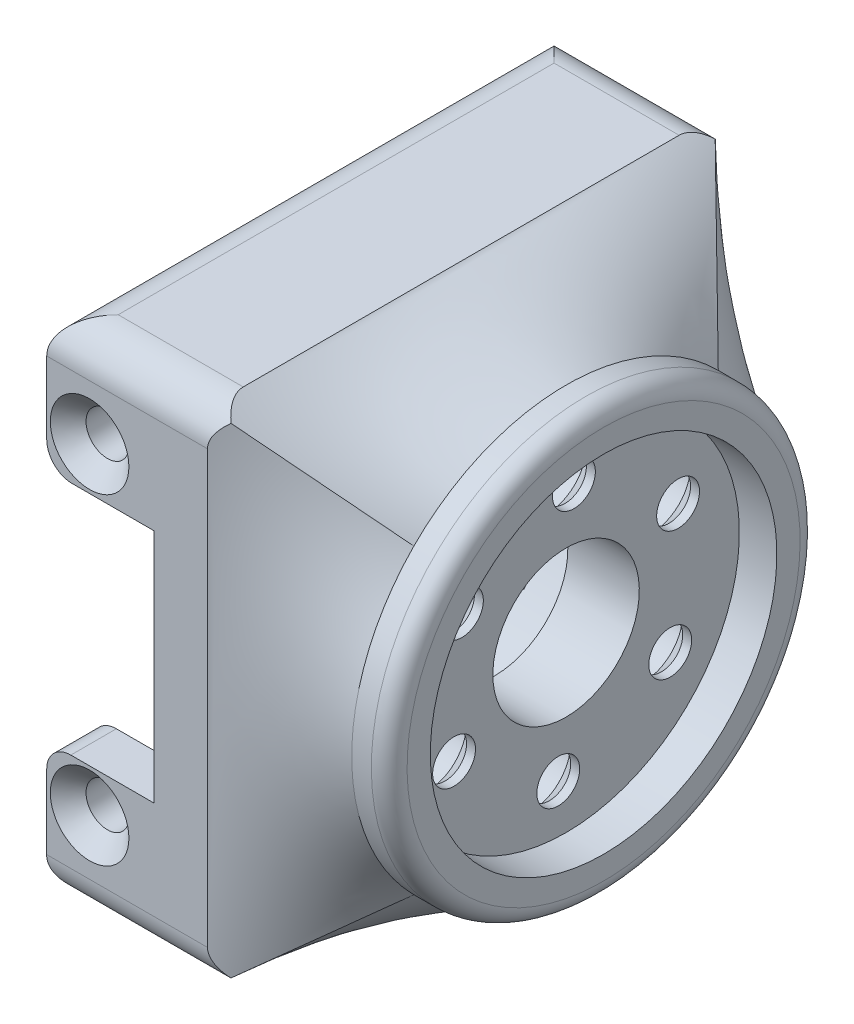
from build123d import *

# Parameters (mm, degrees)
BOSS_EXTRUDE1_DEPTH                                  = 2.5
BOSS_EXTRUDE1_DEPTH_BACK                             = 25.9
CUT_EXTRUDE1_START                                   = -12.2500003
CUT_EXTRUDE1_DEPTH                                   = 24.500001543
CUT_EXTRUDE2_DEPTH                                   = 34.493305247
CUT_EXTRUDE2_DEPTH_BACK                              = 34.493305247
SKETCH6_R                                            = 11.999999661
SKETCH6_R_2                                          = 9.7
BOSS_EXTRUDE2_DEPTH                                  = 2.1
CSK_FOR_M2_COUNTERSUNK_RAISED_HEAD_SCREW_D           = 2.4
CSK_FOR_M2_COUNTERSUNK_RAISED_HEAD_SCREW_DEPTH       = 4
CSK_FOR_M2_COUNTERSUNK_RAISED_HEAD_SCREW_CSINK_D     = 4.4
CSK_FOR_M2_COUNTERSUNK_RAISED_HEAD_SCREW_CSINK_ANGLE = 90
CSK_FOR_M2_COUNTERSUNK_RAISED_HEAD_SCREW_TIP         = 0.721032743
CSK_FOR_M2_COUNTERSUNK_RAISED_HEAD_S_2_D             = 2.4
CSK_FOR_M2_COUNTERSUNK_RAISED_HEAD_S_2_DEPTH         = 4
CSK_FOR_M2_COUNTERSUNK_RAISED_HEAD_S_2_CSINK_D       = 4.4
CSK_FOR_M2_COUNTERSUNK_RAISED_HEAD_S_2_CSINK_ANGLE   = 90
CSK_FOR_M2_COUNTERSUNK_RAISED_HEAD_S_2_TIP           = 0.721032743
CUT_EXTRUDE3_DEPTH                                   = 32.82678972
CUT_EXTRUDE3_DEPTH_BACK                              = 5.871823
SKETCH13_R                                           = 10
CSK_FOR_M2_COUNTERSUNK_RAISED_HEAD_S_3_A_COUNT       = 2
CSK_FOR_M2_COUNTERSUNK_RAISED_HEAD_S_3_A_PITCH       = 7
CSK_FOR_M2_COUNTERSUNK_RAISED_HEAD_S_4_COUNT         = 2
CSK_FOR_M2_COUNTERSUNK_RAISED_HEAD_S_4_PITCH         = 12.124355653
CSK_FOR_M2_COUNTERSUNK_RAISED_HEAD_S_5_COUNT         = 2
CSK_FOR_M2_COUNTERSUNK_RAISED_HEAD_S_5_PITCH         = 14
CSK_FOR_M2_COUNTERSUNK_RAISED_HEAD_S_6_COUNT         = 2
CSK_FOR_M2_COUNTERSUNK_RAISED_HEAD_S_6_PITCH         = 12.124355653
CSK_FOR_M2_COUNTERSUNK_RAISED_HEAD_S_7_COUNT         = 2
CSK_FOR_M2_COUNTERSUNK_RAISED_HEAD_S_7_PITCH         = 7
FILLET1_R                                            = 2
FILLET2_R                                            = 1


with BuildPart() as part:
    # Sketch1 → Boss-Extrude1 (new, two sides: drawn at the far end of the back side and taken through both)
    with BuildSketch(Plane.XY.offset(-BOSS_EXTRUDE1_DEPTH_BACK)):
        with BuildLine():
            Line((29.928177417, 11.570634763), (29.928177417, 14.070634763))
            Line((29.928177417, 14.070634763), (38.928177148, 14.070634763))
            Line((38.928177148, 14.070634763), (38.928177148, -14.099999768))
            Line((38.928177148, -14.099999768), (29.91977661, -14.099999768))
            Line((29.91977661, -14.099999768), (29.91977661, -11.599999768))
            ThreePointArc((29.91977661, -11.599999768), (29.926074346, -11.550137868), (29.928177417, -11.499923848))
            Line((29.928177417, -11.499923848), (29.928177417, -7.95))
            ThreePointArc((29.928177417, -7.95), (30.323588466, -6.995400641), (31.278192136, -6.6))
            Line((31.278192136, -6.6), (34.928177148, -6.6))
            Line((34.928177148, -6.6), (35.928177148, -6.6))
            Line((35.928177148, -6.6), (35.928177148, 6.6))
            Line((35.928177148, 6.6), (35.087455795, 6.6))
            Line((35.087455795, 6.6), (31.348888095, 6.6))
            ThreePointArc((31.348888095, 6.6), (30.34429394, 7.016116524), (29.928177417, 8.020710678))
            Line((29.928177417, 8.020710678), (29.928177417, 11.570634763))
        make_face()
    extrude(amount=BOSS_EXTRUDE1_DEPTH + BOSS_EXTRUDE1_DEPTH_BACK)

    # Cut-Extrude1: read off the stored shape, not the designer's step
    # Cut-Extrude1 outline → Cut-Extrude1 (cut)
    with BuildSketch(Plane(origin=(0, 0, 0), x_dir=(1, 0, 0), z_dir=(0, 1, 0)).offset(CUT_EXTRUDE1_START)):
        Polygon((35.195879318, 0.050001172), (35.36404868, 24.138096471), (29.91977661, 24.138096471), (29.91977661, 0.050001172), align=None)
    extrude(amount=CUT_EXTRUDE1_DEPTH, mode=Mode.SUBTRACT)

    # Loft1: read off the stored shape, not the designer's step
    # Loft1: loft between two sections, ruled curve by curve
    loft1_from = [
        Edge.make_bspline([(45.8, -8.450808127, -2.180385345), (45.8, -7.95082458, -1.684439789), (45.8, -7.388421064, -1.214398248), (45.8, -6.146508219, -0.366276416), (45.8, -5.466939506, 0.01153308), (45.8, -4.015161183, 0.635909719), (45.8, -3.243064682, 0.882176609), (45.8, -1.647180674, 1.214322446), (45.8, -0.823680968, 1.299999661), (45.8, 0.823680968, 1.299999661), (45.8, 1.647180674, 1.214322446), (45.8, 3.243064682, 0.882176609), (45.8, 4.015161183, 0.635909719), (45.8, 5.466939506, 0.01153308), (45.8, 6.146508219, -0.366276416), (45.8, 7.388421064, -1.214398248), (45.8, 7.95082458, -1.684439789), (45.8, 8.450808127, -2.180385345)], [0, 0, 0, 0, 0.125, 0.125, 0.25, 0.25, 0.375, 0.375, 0.5, 0.5, 0.625, 0.625, 0.75, 0.75, 0.875, 0.875, 1, 1, 1, 1], 3),
        Edge.make_bspline([(45.8, 8.450808127, -2.180385345), (45.8, 8.954862543, -2.680368892), (45.8, 9.433327263, -3.244228398), (45.8, 10.297629636, -4.492342043), (45.8, 10.683183568, -5.176664124), (45.8, 11.320842078, -6.64091328), (45.8, 11.572628128, -7.420725214), (45.8, 11.912314661, -9.03382944), (45.8, 11.999999661, -9.866818787), (45.8, 11.999999661, -11.533181213), (45.8, 11.912314661, -12.36617056), (45.8, 11.572628128, -13.979274786), (45.8, 11.320842078, -14.75908672), (45.8, 10.683183568, -16.223335876), (45.8, 10.297629636, -16.907657957), (45.8, 9.433327263, -18.155771602), (45.8, 8.954862543, -18.719631108), (45.8, 8.450808127, -19.219614655)], [0, 0, 0, 0, 0.125, 0.125, 0.25, 0.25, 0.375, 0.375, 0.5, 0.5, 0.625, 0.625, 0.75, 0.75, 0.875, 0.875, 1, 1, 1, 1], 3),
        Edge.make_bspline([(45.8, -8.450808127, -19.219614655), (45.8, -8.954862543, -18.719631108), (45.8, -9.433327263, -18.155771602), (45.8, -10.297629636, -16.907657957), (45.8, -10.683183568, -16.223335876), (45.8, -11.320842078, -14.75908672), (45.8, -11.572628128, -13.979274786), (45.8, -11.912314661, -12.36617056), (45.8, -11.999999661, -11.533181213), (45.8, -11.999999661, -9.866818787), (45.8, -11.912314661, -9.03382944), (45.8, -11.572628128, -7.420725214), (45.8, -11.320842078, -6.64091328), (45.8, -10.683183568, -5.176664124), (45.8, -10.297629636, -4.492342043), (45.8, -9.433327263, -3.244228398), (45.8, -8.954862543, -2.680368892), (45.8, -8.450808127, -2.180385345)], [0, 0, 0, 0, 0.125, 0.125, 0.25, 0.25, 0.375, 0.375, 0.5, 0.5, 0.625, 0.625, 0.75, 0.75, 0.875, 0.875, 1, 1, 1, 1], 3),
        Edge.make_bspline([(45.8, 8.450808127, -19.219614655), (45.8, 7.95082458, -19.715560211), (45.8, 7.388421064, -20.185601752), (45.8, 6.146508219, -21.033723584), (45.8, 5.466939506, -21.41153308), (45.8, 4.015161183, -22.035909719), (45.8, 3.243064682, -22.282176609), (45.8, 1.647180674, -22.614322446), (45.8, 0.823680968, -22.699999661), (45.8, -0.823680968, -22.699999661), (45.8, -1.647180674, -22.614322446), (45.8, -3.243064682, -22.282176609), (45.8, -4.015161183, -22.035909719), (45.8, -5.466939506, -21.41153308), (45.8, -6.146508219, -21.033723584), (45.8, -7.388421064, -20.185601752), (45.8, -7.95082458, -19.715560211), (45.8, -8.450808127, -19.219614655)], [0, 0, 0, 0, 0.125, 0.125, 0.25, 0.25, 0.375, 0.375, 0.5, 0.5, 0.625, 0.625, 0.75, 0.75, 0.875, 0.875, 1, 1, 1, 1], 3),
    ]
    loft1_to = [
        Edge.make_bspline([(38.928177148, -14.099999768, 2.5), (38.928177148, -12.92622333, 2.5), (38.928177148, -11.752446891, 2.5), (38.928177148, -9.404894013, 2.5), (38.928177148, -8.231117574, 2.5), (38.928177148, -5.883564697, 2.5), (38.928177148, -4.709788258, 2.5), (38.928177148, -2.36223538, 2.5), (38.928177148, -1.188458942, 2.5), (38.928177148, 1.159093936, 2.5), (38.928177148, 2.332870375, 2.5), (38.928177148, 4.680423252, 2.5), (38.928177148, 5.854199691, 2.5), (38.928177148, 8.201752569, 2.5), (38.928177148, 9.375529008, 2.5), (38.928177148, 11.723081885, 2.5), (38.928177148, 12.896858324, 2.5), (38.928177148, 14.070634763, 2.5)], [0, 0, 0, 0, 0.125, 0.125, 0.25, 0.25, 0.375, 0.375, 0.5, 0.5, 0.625, 0.625, 0.75, 0.75, 0.875, 0.875, 1, 1, 1, 1], 3),
        Edge.make_bspline([(38.928177148, 14.070634763, 2.5), (38.928177148, 14.070634763, 1.316666667), (38.928177148, 14.070634763, 0.133333333), (38.928177148, 14.070634763, -2.233333333), (38.928177148, 14.070634763, -3.416666667), (38.928177148, 14.070634763, -5.783333333), (38.928177148, 14.070634763, -6.966666667), (38.928177148, 14.070634763, -9.333333333), (38.928177148, 14.070634763, -10.516666667), (38.928177148, 14.070634763, -12.883333333), (38.928177148, 14.070634763, -14.066666667), (38.928177148, 14.070634763, -16.433333333), (38.928177148, 14.070634763, -17.616666667), (38.928177148, 14.070634763, -19.983333333), (38.928177148, 14.070634763, -21.166666667), (38.928177148, 14.070634763, -23.533333333), (38.928177148, 14.070634763, -24.716666667), (38.928177148, 14.070634763, -25.9)], [0, 0, 0, 0, 0.125, 0.125, 0.25, 0.25, 0.375, 0.375, 0.5, 0.5, 0.625, 0.625, 0.75, 0.75, 0.875, 0.875, 1, 1, 1, 1], 3),
        Edge.make_bspline([(38.928177148, -14.099999768, -25.9), (38.928177148, -14.099999768, -24.716666667), (38.928177148, -14.099999768, -23.533333333), (38.928177148, -14.099999768, -21.166666667), (38.928177148, -14.099999768, -19.983333333), (38.928177148, -14.099999768, -17.616666667), (38.928177148, -14.099999768, -16.433333333), (38.928177148, -14.099999768, -14.066666667), (38.928177148, -14.099999768, -12.883333333), (38.928177148, -14.099999768, -10.516666667), (38.928177148, -14.099999768, -9.333333333), (38.928177148, -14.099999768, -6.966666667), (38.928177148, -14.099999768, -5.783333333), (38.928177148, -14.099999768, -3.416666667), (38.928177148, -14.099999768, -2.233333333), (38.928177148, -14.099999768, 0.133333333), (38.928177148, -14.099999768, 1.316666667), (38.928177148, -14.099999768, 2.5)], [0, 0, 0, 0, 0.125, 0.125, 0.25, 0.25, 0.375, 0.375, 0.5, 0.5, 0.625, 0.625, 0.75, 0.75, 0.875, 0.875, 1, 1, 1, 1], 3),
        Edge.make_bspline([(38.928177148, 14.070634763, -25.9), (38.928177148, 12.896858324, -25.9), (38.928177148, 11.723081885, -25.9), (38.928177148, 9.375529008, -25.9), (38.928177148, 8.201752569, -25.9), (38.928177148, 5.854199691, -25.9), (38.928177148, 4.680423252, -25.9), (38.928177148, 2.332870375, -25.9), (38.928177148, 1.159093936, -25.9), (38.928177148, -1.188458942, -25.9), (38.928177148, -2.36223538, -25.9), (38.928177148, -4.709788258, -25.9), (38.928177148, -5.883564697, -25.9), (38.928177148, -8.231117574, -25.9), (38.928177148, -9.404894013, -25.9), (38.928177148, -11.752446891, -25.9), (38.928177148, -12.92622333, -25.9), (38.928177148, -14.099999768, -25.9)], [0, 0, 0, 0, 0.125, 0.125, 0.25, 0.25, 0.375, 0.375, 0.5, 0.5, 0.625, 0.625, 0.75, 0.75, 0.875, 0.875, 1, 1, 1, 1], 3),
    ]
    loft1 = Solid(Shell([*[Face.make_surface_from_curves(loft1_from[k], loft1_to[k]) for k in range(4)], Face(Wire(loft1_from)), Face(Wire(loft1_to))]))
    add(loft1)

    # Sketch5 → Cut-Extrude2 (cut, two sides: drawn at the far end of the back side and taken through both)
    with BuildSketch(Plane(origin=(45.8, 0, 0), x_dir=(0, 0, -1), z_dir=(1, 0, 0)).offset(-CUT_EXTRUDE2_DEPTH_BACK)):
        with BuildLine():
            ThreePointArc((14.791927995, -0.257148361), (10.957148361, 4.091927995), (6.608072005, 0.257148361))
            ThreePointArc((6.608072005, 0.257148361), (10.442851639, -4.091927995), (14.791927995, -0.257148361))
        make_face()
    extrude(amount=CUT_EXTRUDE2_DEPTH + CUT_EXTRUDE2_DEPTH_BACK, mode=Mode.SUBTRACT)

    # Sketch6 → Boss-Extrude2 (add)
    with BuildSketch(Plane(origin=(45.8, 0, 0), x_dir=(0, 0, -1), z_dir=(1, 0, 0))):
        with Locations(Location((10.7, 0, 0), (0, 0, 224.767695716))):
            Circle(SKETCH6_R)
        with Locations(Location((10.7, 0, 0), (0, 0, 90))):
            Circle(SKETCH6_R_2, mode=Mode.SUBTRACT)
    extrude(amount=BOSS_EXTRUDE2_DEPTH)

    # CSK for M2 Countersunk Raised Head Screw
    with Locations(Plane.XY.offset(2.5)):
        with Locations((32.328177417, 9), (32.328177417, -9)):
            CounterSinkHole(CSK_FOR_M2_COUNTERSUNK_RAISED_HEAD_SCREW_D / 2, CSK_FOR_M2_COUNTERSUNK_RAISED_HEAD_SCREW_CSINK_D / 2, depth=CSK_FOR_M2_COUNTERSUNK_RAISED_HEAD_SCREW_DEPTH, counter_sink_angle=CSK_FOR_M2_COUNTERSUNK_RAISED_HEAD_SCREW_CSINK_ANGLE)
            with Locations((0, 0, -(CSK_FOR_M2_COUNTERSUNK_RAISED_HEAD_SCREW_DEPTH + CSK_FOR_M2_COUNTERSUNK_RAISED_HEAD_SCREW_TIP / 2))):  # 118° drill point
                Cone(0, CSK_FOR_M2_COUNTERSUNK_RAISED_HEAD_SCREW_D / 2, CSK_FOR_M2_COUNTERSUNK_RAISED_HEAD_SCREW_TIP, mode=Mode.SUBTRACT)

    # CSK for M2 Countersunk Raised Head S 2
    with Locations(Plane(origin=(0, 0, -25.9), x_dir=(-1, 0, 0), z_dir=(0, 0, -1))):
        with Locations((-32.328177417, -9), (-32.328177417, 9)):
            CounterSinkHole(CSK_FOR_M2_COUNTERSUNK_RAISED_HEAD_S_2_D / 2, CSK_FOR_M2_COUNTERSUNK_RAISED_HEAD_S_2_CSINK_D / 2, depth=CSK_FOR_M2_COUNTERSUNK_RAISED_HEAD_S_2_DEPTH, counter_sink_angle=CSK_FOR_M2_COUNTERSUNK_RAISED_HEAD_S_2_CSINK_ANGLE)
            with Locations((0, 0, -(CSK_FOR_M2_COUNTERSUNK_RAISED_HEAD_S_2_DEPTH + CSK_FOR_M2_COUNTERSUNK_RAISED_HEAD_S_2_TIP / 2))):  # 118° drill point
                Cone(0, CSK_FOR_M2_COUNTERSUNK_RAISED_HEAD_S_2_D / 2, CSK_FOR_M2_COUNTERSUNK_RAISED_HEAD_S_2_TIP, mode=Mode.SUBTRACT)

    # Sketch13 → Cut-Extrude3 (cut, two sides: drawn at the far end of the back side and taken through both)
    with BuildSketch(Plane.ZY.offset(-35.928177148).offset(-CUT_EXTRUDE3_DEPTH_BACK)):
        with Locations(Location((-10.7, 0, 0), (0, 0, 318.70012721))):
            Circle(SKETCH13_R)
    extrude(amount=CUT_EXTRUDE3_DEPTH + CUT_EXTRUDE3_DEPTH_BACK, mode=Mode.SUBTRACT)

    # Sketch17 → CSK for M2 Countersunk Raised Head S 3 (revolve, cut)
    with BuildSketch(Plane(origin=(41.8, 3.112894851, -16.969759616), x_dir=(0, 0, 1), z_dir=(0, 1, 0))):
        Polygon((0, 0), (0, 6.1), (1.2, 6.1), (1.2, 3.5), (2.2, 2.5), (2.2, 0), align=None)
    csk_for_m2_countersunk_raised_head_s_3 = revolve(axis=Axis((35.45, 3.112894851, -16.969759616), (1, 0, 0)), mode=Mode.SUBTRACT)

    # CSK for M2 Countersunk Raised Head S 3 a: CSK for M2 Countersunk Raised Head S 3 ×2
    with Locations(*[Vector(0, 0.553331953965189, 0.8329608326452487) * (i * CSK_FOR_M2_COUNTERSUNK_RAISED_HEAD_S_3_A_PITCH) for i in range(1, CSK_FOR_M2_COUNTERSUNK_RAISED_HEAD_S_3_A_COUNT)]):
        add(csk_for_m2_countersunk_raised_head_s_3, mode=Mode.SUBTRACT)

    # CSK for M2 Countersunk Raised Head S 4: CSK for M2 Countersunk Raised Head S 3 ×2
    with Locations(*[Vector(0, 0.06271911253691091, 0.9980312184108182) * (i * CSK_FOR_M2_COUNTERSUNK_RAISED_HEAD_S_4_PITCH) for i in range(1, CSK_FOR_M2_COUNTERSUNK_RAISED_HEAD_S_4_COUNT)]):
        add(csk_for_m2_countersunk_raised_head_s_3, mode=Mode.SUBTRACT)

    # CSK for M2 Countersunk Raised Head S 5: CSK for M2 Countersunk Raised Head S 3 ×2
    with Locations(*[Vector(0, -0.44469926444562935, 0.8956799451821595) * (i * CSK_FOR_M2_COUNTERSUNK_RAISED_HEAD_S_5_PITCH) for i in range(1, CSK_FOR_M2_COUNTERSUNK_RAISED_HEAD_S_5_COUNT)]):
        add(csk_for_m2_countersunk_raised_head_s_3, mode=Mode.SUBTRACT)

    # CSK for M2 Countersunk Raised Head S 6: CSK for M2 Countersunk Raised Head S 3 ×2
    with Locations(*[Vector(0, -0.8329608326452488, 0.553331953965189) * (i * CSK_FOR_M2_COUNTERSUNK_RAISED_HEAD_S_6_PITCH) for i in range(1, CSK_FOR_M2_COUNTERSUNK_RAISED_HEAD_S_6_COUNT)]):
        add(csk_for_m2_countersunk_raised_head_s_3, mode=Mode.SUBTRACT)

    # CSK for M2 Countersunk Raised Head S 7: CSK for M2 Countersunk Raised Head S 3 ×2
    with Locations(*[Vector(0, -0.9980312184108182, 0.06271911253691133) * (i * CSK_FOR_M2_COUNTERSUNK_RAISED_HEAD_S_7_PITCH) for i in range(1, CSK_FOR_M2_COUNTERSUNK_RAISED_HEAD_S_7_COUNT)]):
        add(csk_for_m2_countersunk_raised_head_s_3, mode=Mode.SUBTRACT)

    # Fillet1
    # the kernel refuses this fillet: 2 mm, written as the material it takes off along each edge
    with BuildSketch(Plane(origin=(29.928177417, 14.070634763, 7.5), x_dir=(1, 0, 0), z_dir=(0, 0, -1))) as fillet1_piece_1:
        with BuildLine():
            CenterArc((FILLET1_R, FILLET1_R), FILLET1_R, 180, 90)
            Line((0, FILLET1_R), (0, 0))
            Line((0, 0), (FILLET1_R, 0))
        make_face()
    extrude(amount=38.4, mode=Mode.SUBTRACT)
    with BuildSketch(Plane(origin=(29.91977661, -14.099999768, 7.5), x_dir=(1, 0, 0), z_dir=(0, 0, -1))) as fillet1_piece_2:
        with BuildLine():
            CenterArc((FILLET1_R, -FILLET1_R), FILLET1_R, 90, 90)
            Line((0, -FILLET1_R), (0, 0))
            Line((0, 0), (FILLET1_R, 0))
        make_face()
    extrude(amount=38.4, mode=Mode.SUBTRACT)
    with BuildSketch(Plane(origin=(24.928177417, 14.070634763, 2.5), x_dir=(0, -1, 0), z_dir=(1, 0, 0)), Plane(origin=(24.928177417, 14.070634763, -25.9), x_dir=(0, 0, 1), z_dir=(1, 0, 0))) as fillet1_piece_3:
        with BuildLine():
            CenterArc((FILLET1_R, FILLET1_R), FILLET1_R, 180, 90)
            Line((0, FILLET1_R), (0, 0))
            Line((0, 0), (FILLET1_R, 0))
        make_face()
    extrude(amount=18.999999731, mode=Mode.SUBTRACT)
    with BuildSketch(Plane(origin=(43.928177148, -14.099999768, -25.9), x_dir=(0, 0, 1), z_dir=(-1, 0, 0)), Plane(origin=(43.928177148, -14.099999768, 2.5), x_dir=(0, 1, 0), z_dir=(-1, 0, 0))) as fillet1_piece_4:
        with BuildLine():
            CenterArc((FILLET1_R, FILLET1_R), FILLET1_R, 180, 90)
            Line((0, FILLET1_R), (0, 0))
            Line((0, 0), (FILLET1_R, 0))
        make_face()
    extrude(amount=19.008400538, mode=Mode.SUBTRACT)

    # Fillet2
    fillet2_edges = [part.edges().sort_by_distance(p)[0] for p in [
        (47.9, 8.450808128, -19.219614654),
    ]]
    fillet(fillet2_edges, radius=FILLET2_R)


solid = part.part
